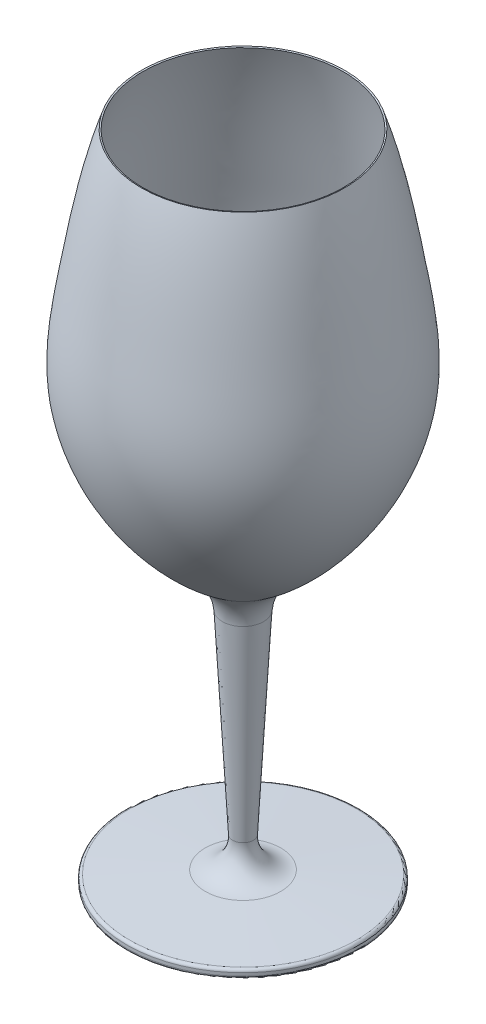
from build123d import *

# Parameters (mm, degrees)
REVOLVE_THIN1_OUTLINE_W   = 7.365807556
REVOLVE_THIN1_OUTLINE_H   = 0.5
REVOLVE_THIN1_OUTLINE_W_2 = 0.134192444
FILLET1_R                 = 10
FILLET2_R                 = 16
FILLET3_R                 = 1


# Read off the part's stored shape, not the designer's step: Revolve-Thin1
with BuildPart() as part:
    # Revolve-Thin1 outline → Revolve-Thin1 (revolve)
    with BuildSketch(Plane.XY):
        with Locations((3.682903778, 90.25)):
            Rectangle(REVOLVE_THIN1_OUTLINE_W, REVOLVE_THIN1_OUTLINE_H)
        with BuildLine():
            add(Edge.make_bspline(
                [(7.5, 90.577978433), (7.455285949, 90.551931479), (7.410555095, 90.525938631), (7.365807556, 90.5)],
                knots=[0.99893007, 0.99893007, 0.99893007, 0.99893007, 1, 1, 1, 1], degree=3))
            Line((7.365807556, 90.5), (7.5, 90.5))
            Line((7.5, 90.5), (7.5, 90.577978433))
        make_face()
        with Locations((7.432903778, 90.25)):
            Rectangle(REVOLVE_THIN1_OUTLINE_W_2, REVOLVE_THIN1_OUTLINE_H)
        with BuildLine():
            add(Edge.make_bspline(
                [(34.526035746, 116.224068176), (34.512660612, 116.204150697), (34.499276892, 116.184238728), (27.396765127, 105.626990517), (17.903178429, 96.638067113), (7.5, 90.577978433)],
                knots=[0.749529738, 0.749529738, 0.749529738, 0.749529738, 0.75, 0.75, 0.99893007, 0.99893007, 0.99893007, 0.99893007], degree=3))
            Line((7.5, 90.577978433), (7.5, 90.5))
            Line((7.5, 90.5), (8.352912818, 90.5))
            add(Edge.make_bspline(
                [(34.526035746, 115.332949182), (27.575400822, 105.173919249), (18.409466047, 96.486433496), (8.352912818, 90.5)],
                knots=[0.753639532, 0.753639532, 0.753639532, 0.753639532, 0.993242921, 0.993242921, 0.993242921, 0.993242921], degree=3))
            Line((34.526035746, 115.332949182), (34.526035746, 116.224068176))
        make_face()
        with BuildLine():
            Line((8.352912818, 90.5), (7.5, 90.5))
            Line((7.5, 90.5), (7.5, 90))
            add(Edge.make_bspline(
                [(8.352912818, 90.5), (8.069306953, 90.331175989), (7.784992776, 90.16450013), (7.5, 90)],
                knots=[0.993242921, 0.993242921, 0.993242921, 0.993242921, 1, 1, 1, 1], degree=3))
        make_face()
        with BuildLine():
            add(Edge.make_bspline(
                [(35, 116.937654659), (34.843239639, 116.699022317), (34.685245979, 116.461154885), (34.526035746, 116.224068176)],
                knots=[0.743931995, 0.743931995, 0.743931995, 0.743931995, 0.749529738, 0.749529738, 0.749529738, 0.749529738], degree=3))
            Line((34.526035746, 116.224068176), (34.526035746, 115.332949182))
            add(Edge.make_bspline(
                [(35, 116.033110225), (34.843184029, 115.798961501), (34.685190644, 115.565569566), (34.526035746, 115.332949182)],
                knots=[0.748153119, 0.748153119, 0.748153119, 0.748153119, 0.753639532, 0.753639532, 0.753639532, 0.753639532], degree=3))
            Line((35, 116.033110225), (35, 116.937654659))
        make_face()
        with BuildLine():
            add(Edge.make_bspline(
                [(35, 223.406176232), (38.707754789, 211.992882418), (41.019034398, 200.307274966), (43.602577081, 185.350494264), (44.119501526, 182.246673107), (45.155101131, 176.021305771), (45.666413266, 172.90348054), (46.954080187, 163.557105891), (47.483447687, 157.336251858), (46.887857201, 148.10906378), (46.448454036, 145.046089868), (45.124841561, 138.98077957), (44.242019923, 135.979713916), (41.104468819, 127.423109067), (38.330596439, 122.007737575), (35, 116.937654659)],
                knots=[0.010062995, 0.010062995, 0.010062995, 0.010062995, 0.25, 0.25, 0.3125, 0.3125, 0.375, 0.375, 0.5, 0.5, 0.5625, 0.5625, 0.625, 0.625, 0.743931995, 0.743931995, 0.743931995, 0.743931995], degree=3))
            Line((35, 116.937654659), (35, 116.033110225))
            add(Edge.make_bspline(
                [(47.720690898, 155.470930382), (47.720690902, 153.643424155), (47.202796244, 139.839119187), (41.88477425, 126.313065149), (35, 116.033110225)],
                knots=[0.470604099, 0.470604099, 0.470604099, 0.470604099, 0.507280243, 0.748153119, 0.748153119, 0.748153119, 0.748153119], degree=3))
            add(Edge.make_bspline(
                [(35.053402076, 224.840758405), (39.935404776, 210.255770266), (43.812104428, 187.210591777), (47.720690877, 163.624535777), (47.720690898, 155.470930382)],
                knots=[0.001113252, 0.001113252, 0.001113252, 0.001113252, 0.306969744, 0.470604099, 0.470604099, 0.470604099, 0.470604099], degree=3))
            Line((35.053402076, 224.840758405), (35, 224.840758405))
            Line((35, 224.840758405), (35, 223.406176232))
        make_face()
        with BuildLine():
            Line((35, 224.840758405), (34.526035746, 224.840758405))
            add(Edge.make_bspline(
                [(34.526035746, 224.840758405), (34.68653601, 224.363047867), (34.844496189, 223.884851546), (35, 223.406176232)],
                knots=[0, 0, 0, 0, 0.010062995, 0.010062995, 0.010062995, 0.010062995], degree=3))
            Line((35, 223.406176232), (35, 224.840758405))
        make_face()
        Polygon((35, 225), (34.526035746, 224.840758405), (35, 224.840758405), align=None)
        with BuildLine():
            add(Edge.make_bspline(
                [(35, 225), (35.017831987, 224.946925146), (35.035632641, 224.893844612), (35.053402076, 224.840758405)],
                knots=[0, 0, 0, 0, 0.001113252, 0.001113252, 0.001113252, 0.001113252], degree=3))
            Line((35, 225), (35, 224.840758405))
            Line((35, 224.840758405), (35.053402076, 224.840758405))
        make_face()
    revolve(axis=Axis((0, 0, 0), (0, 1, 0)))

    # Sketch2 → Revolve1 (revolve)
    with BuildSketch(Plane.XY, mode=Mode.PRIVATE) as revolve1_sk:
        Polygon((0, 90), (0, 0), (40, 0), (40, 3), (3, 5), (7.5, 90), align=None)
    revolve(revolve1_sk.sketch.rotate(Axis((0, 231.75, 0), (0, -1, 0)), 90), axis=Axis((0, 231.75, 0), (0, -1, 0)))

    # Fillet1
    fillet1_edges = [part.edges().sort_by_distance(p)[0] for p in [
        (0, 5, -3),
    ]]
    fillet(fillet1_edges, radius=FILLET1_R)

    # Fillet2
    fillet2_edges = [part.edges().sort_by_distance(p)[0] for p in [
        (-5.303300859, 90, -5.303300859),
    ]]
    fillet(fillet2_edges, radius=FILLET2_R)

    # Fillet3
    fillet3_edges = [part.edges().sort_by_distance(p)[0] for p in [
        (0, 0, -40),
        (0, 3, -40),
    ]]
    fillet(fillet3_edges, radius=FILLET3_R)


solid = part.part
